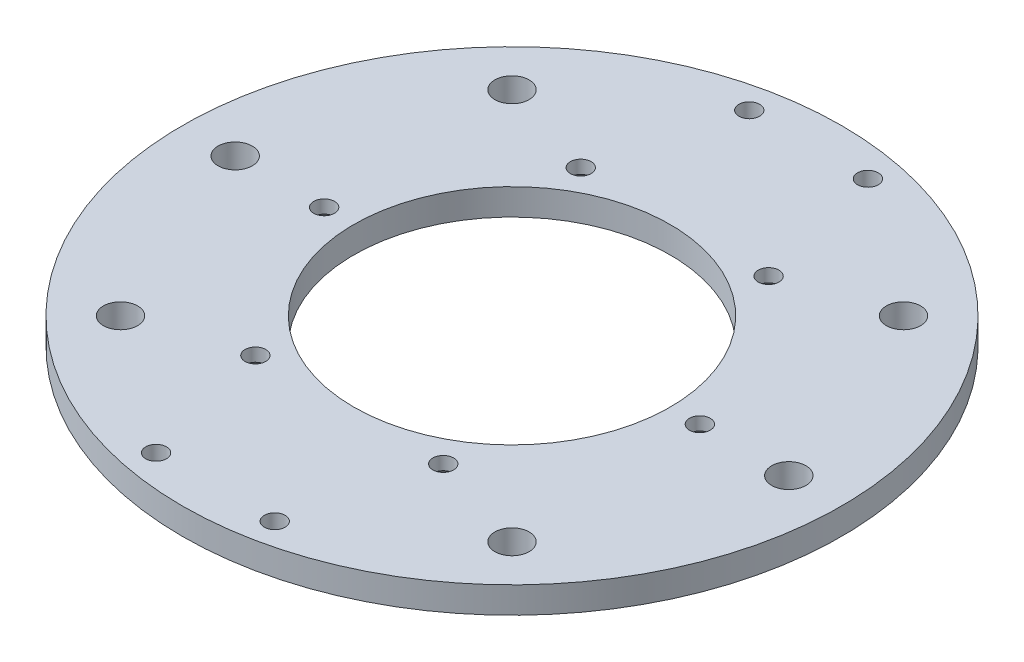
from build123d import *

# Parameters (mm, degrees)
SKETCH_1_R                  = 50
SKETCH_1_R_2                = 24
EXTRUDE_1_DEPTH             = 4
PATTERN_CIRCULAR_1_COUNT    = 6
CHAMFER_1_SIZE              = 2
HOLE_WIZARD_M32_D           = 3.15
PATTERN_LINEAR_1_COUNT      = 2
PATTERN_LINEAR_1_PITCH      = 18
PATTERN_LINEAR_1_COUNT_DIR2 = 2
PATTERN_LINEAR_1_PITCH_DIR2 = 90
HOLE_WIZARD_M52_D           = 5.2
PATTERN_CIRCULAR_3_COUNT    = 2
PATTERN_CIRCULAR_3_ANGLE    = 45
F_3_THE_OTHER_WAY_COUNT     = 2
F_3_THE_OTHER_WAY_ANGLE     = 45


with BuildPart() as part:
    # Эскиз1 → Бобышка-Вытянуть1 (new body)
    with BuildSketch(Plane(origin=(0, 0, 0), x_dir=(1, 0, 0), z_dir=(0, 1, 0))):
        Circle(SKETCH_1_R)
        Circle(SKETCH_1_R_2, mode=Mode.SUBTRACT)
    extrude(amount=EXTRUDE_1_DEPTH)

    # Эскиз3 → Сверло под метчик  спиральное M31 (revolve, cut)
    with BuildSketch(Plane(origin=(28.5, 4, 0), x_dir=(0, 0, 1), z_dir=(1, 0, 0))):
        Polygon((0, 0), (0, 8.946355475), (1.575, 8), (1.575, 0), align=None)
    hole_wizard_m31 = revolve(axis=Axis((28.5, 10.35, 0), (0, -1, 0)), mode=Mode.SUBTRACT)

    # Круговой массив1: Сверло под метчик  спиральное M31 ×6 about axis
    pattern_circular_1_axis = Axis((0, 4, 0), (0, 1, 0))
    for i in range(1, PATTERN_CIRCULAR_1_COUNT):
        add(hole_wizard_m31.rotate(pattern_circular_1_axis, i * 360 / PATTERN_CIRCULAR_1_COUNT), mode=Mode.SUBTRACT)

    # Фаска1
    chamfer_1_edges = [part.edges().sort_by_distance(p)[0] for p in [
        (-12.886009989, 0, 25.469224008),
        (-28.5, 0, 1.575),
        (-15.613990011, 0, -23.894224008),
        (12.886009989, 0, -25.469224008),
        (28.5, 0, -1.575),
        (15.613990011, 0, 23.894224008),
    ]]
    chamfer(chamfer_1_edges, length=CHAMFER_1_SIZE)

    # Сверло под метчик  спиральное M32 (through all)
    with Locations(Plane(origin=(0, 0, 0), x_dir=(-1, 0, 0), z_dir=(0, -1, 0))):
        with Locations((-9, -45)):
            hole_wizard_m32 = Hole(HOLE_WIZARD_M32_D / 2)

    # Линейный массив1: Hole Wizard M32 2 × 2
    with Locations(*[(-i * PATTERN_LINEAR_1_PITCH, 0, -j * PATTERN_LINEAR_1_PITCH_DIR2) for i in range(PATTERN_LINEAR_1_COUNT) for j in range(PATTERN_LINEAR_1_COUNT_DIR2) if (i, j) != (0, 0)]):
        add(hole_wizard_m32, mode=Mode.SUBTRACT)

    # Сверло под метчик  спиральное M52 (through all)
    with Locations(Plane(origin=(0, 0, 0), x_dir=(-1, 0, 0), z_dir=(0, -1, 0))):
        with Locations((42, 0), (-42, 0)):
            hole_wizard_m52 = Hole(HOLE_WIZARD_M52_D / 2)

    # Круговой массив3: Сверло под метчик  спиральное M52 ×2 about axis
    pattern_circular_3_axis = Axis((0, 0, 0), (0, 1, 0))
    for i in range(1, PATTERN_CIRCULAR_3_COUNT):
        add(hole_wizard_m52.rotate(pattern_circular_3_axis, i * PATTERN_CIRCULAR_3_ANGLE / (PATTERN_CIRCULAR_3_COUNT - 1)), mode=Mode.SUBTRACT)

    # 3 the other way: Сверло под метчик  спиральное M52 ×2 about axis
    f_3_the_other_way_axis = Axis((0, 0, 0), (0, -1, 0))
    for i in range(1, F_3_THE_OTHER_WAY_COUNT):
        add(hole_wizard_m52.rotate(f_3_the_other_way_axis, i * F_3_THE_OTHER_WAY_ANGLE / (F_3_THE_OTHER_WAY_COUNT - 1)), mode=Mode.SUBTRACT)


solid = part.part
